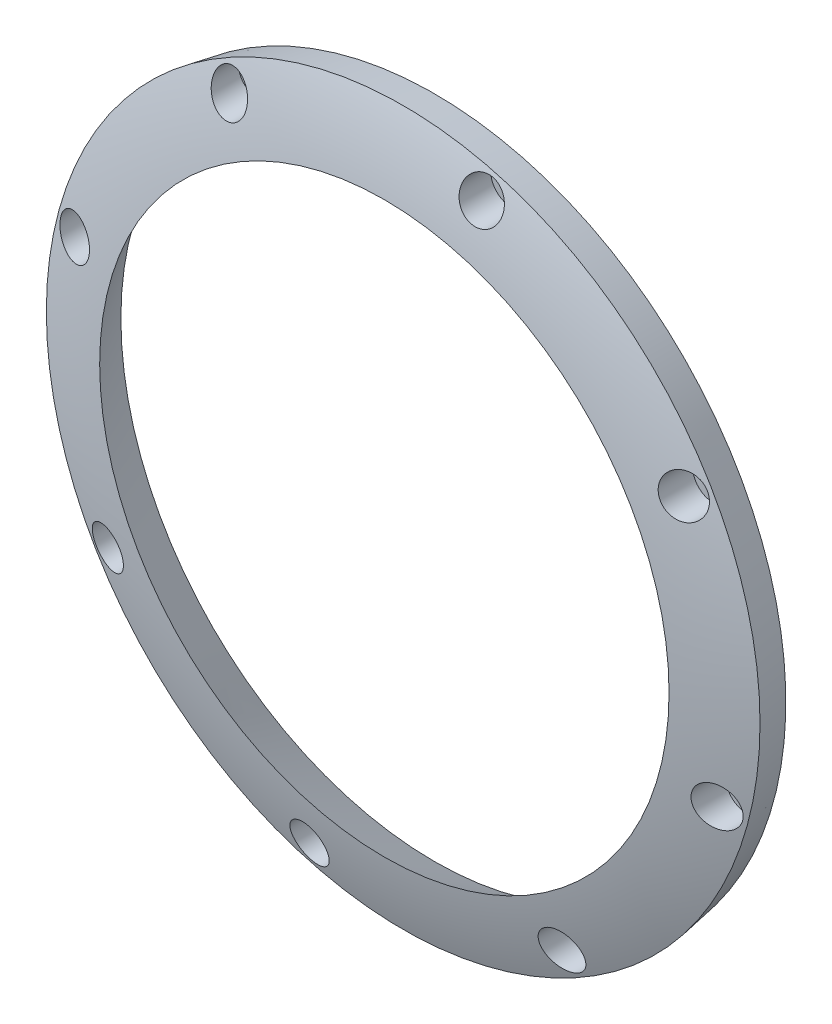
from build123d import *

# Parameters (mm, degrees)
SKETCH3_R          = 2.65
CUT_EXTRUDE1_DEPTH = 162.679198301
CUT_EXTRUDE2_START = -3
SKETCH4_R          = 6.5
CUT_EXTRUDE2_DEPTH = 159.679198301
CIRPATTERN1_COUNT  = 8


with BuildPart() as part:
    # Sketch2 → Revolve1 (revolve)
    with BuildSketch(Plane(origin=(0, 0, 0), x_dir=(1, 0, 0), z_dir=(0, 1, 0))):
        with BuildLine():
            Line((-100, 0), (-112, 0))
            Line((-112, 0), (-113.763269807, -10))
            ThreePointArc((-113.763269807, -10), (-102.383858616, -13.463950118), (-90.762395693, -16))
            Line((-90.762395693, -16), (-100, 0))
        make_face()
    revolve(axis=Axis((0, 0, 0), (0, 0, 1)))

    # Sketch3 → Cut-Extrude1 (cut, through all)
    with BuildSketch(Plane(origin=(0, 0, 0), x_dir=(-1, 0, 0), z_dir=(0, 0, -1))):
        with Locations((-102.388137587, -27.434818781)):
            Circle(SKETCH3_R)
    cut_extrude1 = extrude(amount=-CUT_EXTRUDE1_DEPTH, mode=Mode.SUBTRACT)

    # Sketch4 → Cut-Extrude2 (cut, through all)
    with BuildSketch(Plane(origin=(0, 0, 0), x_dir=(-1, 0, 0), z_dir=(0, 0, -1)).offset(CUT_EXTRUDE2_START)):
        with Locations((-102.388137587, -27.434818781)):
            Circle(SKETCH4_R)
    cut_extrude2 = extrude(amount=-CUT_EXTRUDE2_DEPTH, mode=Mode.SUBTRACT)

    # CirPattern1: Cut-Extrude1, Cut-Extrude2 ×8 about axis
    cirpattern1_axis = Axis((0, 0, 0), (0, 0, -1))
    add([cut_extrude1.rotate(cirpattern1_axis, i * 360 / CIRPATTERN1_COUNT) for i in range(1, CIRPATTERN1_COUNT)], mode=Mode.SUBTRACT)
    add([cut_extrude2.rotate(cirpattern1_axis, i * 360 / CIRPATTERN1_COUNT) for i in range(1, CIRPATTERN1_COUNT)], mode=Mode.SUBTRACT)


solid = part.part
